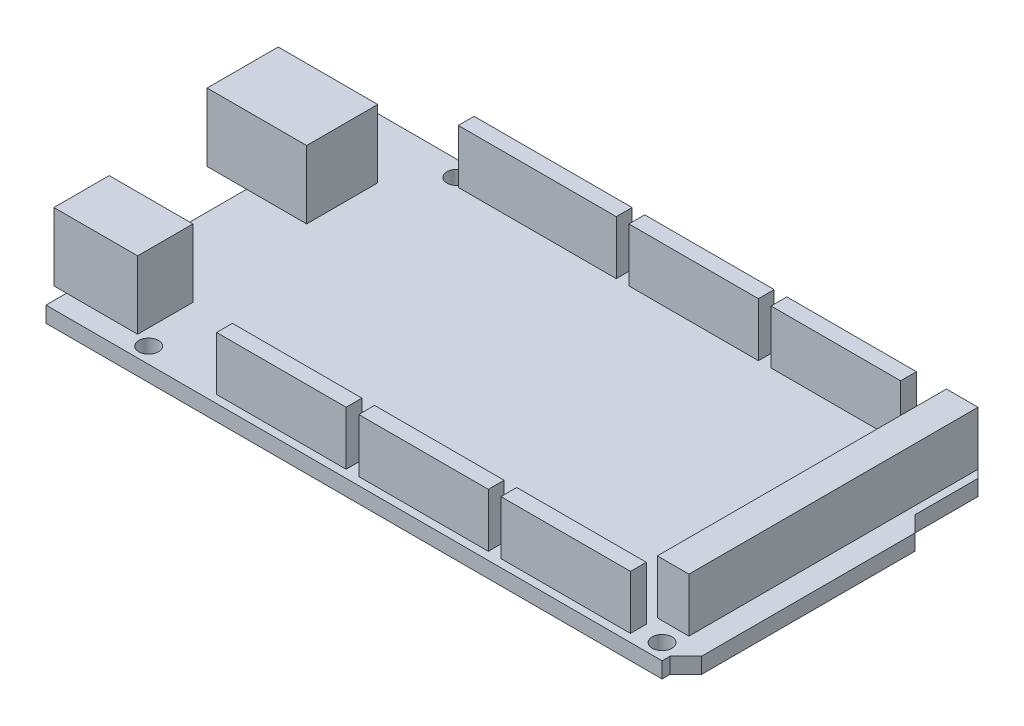
from build123d import *

# Parameters (mm, degrees)
BOSS_EXTRUDE1_DEPTH   = 2.54
SKETCH3_R             = 1.5875
CUT_EXTRUDE1_DEPTH    = 59.557880768
CHAMFER1_SIZE         = 2.54
SKETCH4_W             = 25.4
SKETCH4_H             = 2.54
BOSS_EXTRUDE2_DEPTH   = 8.636
SKETCH4_W_2           = 20.828
BOSS_EXTRUDE2_2_DEPTH = 8.636
BOSS_EXTRUDE2_3_DEPTH = 8.636
SKETCH4_W_3           = 5.08
SKETCH4_H_2           = 46.482
BOSS_EXTRUDE2_4_DEPTH = 8.636
BOSS_EXTRUDE2_5_DEPTH = 8.636
BOSS_EXTRUDE2_6_DEPTH = 8.636
BOSS_EXTRUDE2_7_DEPTH = 8.636
SKETCH5_W             = 16.002
SKETCH5_H             = 11.43
BOSS_EXTRUDE3_DEPTH   = 10.922
SKETCH5_W_2           = 13.462
SKETCH5_H_2           = 8.89
BOSS_EXTRUDE3_2_DEPTH = 10.922


with BuildPart() as part:
    # Sketch2 → Boss-Extrude1 (new body)
    with BuildSketch(Plane(origin=(0, 0, 0), x_dir=(1, 0, 0), z_dir=(0, 1, 0))):
        Polygon((-49.53, 26.67), (49.53, 26.67), (49.53, 13.97), (52.07, 13.97), (52.07, -25.4), (49.53, -25.4), (49.53, -26.67), (-49.53, -26.67), align=None)
    extrude(amount=BOSS_EXTRUDE1_DEPTH)

    # Sketch3 → Cut-Extrude1 (cut, through all)
    with BuildSketch(Plane(origin=(0, 2.54, 0), x_dir=(1, 0, 0), z_dir=(0, 1, 0))):
        with Locations(Location((-34.29, 24.13, 0), (0, 0, 270))):
            Circle(SKETCH3_R)
        with Locations(Location((40.64, 24.13, 0), (0, 0, 270))):
            Circle(SKETCH3_R)
        with Locations(Location((46.99, -24.13, 0), (0, 0, 270))):
            Circle(SKETCH3_R)
        with Locations(Location((-35.56, -24.13, 0), (0, 0, 270))):
            Circle(SKETCH3_R)
    extrude(amount=-CUT_EXTRUDE1_DEPTH, mode=Mode.SUBTRACT)

    # Chamfer1
    chamfer1_edges = [part.edges().sort_by_distance(p)[0] for p in [
        (52.07, 1.27, 25.4),
        (49.53, 1.27, -26.67),
        (52.07, 1.27, -13.97),
    ]]
    chamfer(chamfer1_edges, length=CHAMFER1_SIZE - 0.0001)  # a hair under: the kernel refuses the full size


with BuildPart() as body_2:
    # Sketch4 → Boss-Extrude2 (new body)
    with BuildSketch(Plane(origin=(0, 2.54, 0), x_dir=(1, 0, 0), z_dir=(0, 1, 0))):
        with Locations((-20.066, 24.13)):
            Rectangle(SKETCH4_W, SKETCH4_H)
    extrude(amount=BOSS_EXTRUDE2_DEPTH)


with BuildPart() as body_3:
    # Sketch4 → Boss-Extrude2 2 (new body)
    with BuildSketch(Plane(origin=(0, 2.54, 0), x_dir=(1, 0, 0), z_dir=(0, 1, 0))):
        with Locations((5.08, 24.13)):
            Rectangle(SKETCH4_W_2, SKETCH4_H)
    extrude(amount=BOSS_EXTRUDE2_2_DEPTH)


with BuildPart() as body_4:
    # Sketch4 → Boss-Extrude2 3 (new body)
    with BuildSketch(Plane(origin=(0, 2.54, 0), x_dir=(1, 0, 0), z_dir=(0, 1, 0))):
        with Locations((27.94, 24.13)):
            Rectangle(SKETCH4_W_2, SKETCH4_H)
    extrude(amount=BOSS_EXTRUDE2_3_DEPTH)


with BuildPart() as body_5:
    # Sketch4 → Boss-Extrude2 4 (new body)
    with BuildSketch(Plane(origin=(0, 2.54, 0), x_dir=(1, 0, 0), z_dir=(0, 1, 0))):
        with Locations((45.72, 2.159)):
            Rectangle(SKETCH4_W_3, SKETCH4_H_2)
    extrude(amount=BOSS_EXTRUDE2_4_DEPTH)


with BuildPart() as body_6:
    # Sketch4 → Boss-Extrude2 5 (new body)
    with BuildSketch(Plane(origin=(0, 2.54, 0), x_dir=(1, 0, 0), z_dir=(0, 1, 0))):
        with Locations((32.766, -24.13)):
            Rectangle(SKETCH4_W_2, SKETCH4_H)
    extrude(amount=BOSS_EXTRUDE2_5_DEPTH)


with BuildPart() as body_7:
    # Sketch4 → Boss-Extrude2 6 (new body)
    with BuildSketch(Plane(origin=(0, 2.54, 0), x_dir=(1, 0, 0), z_dir=(0, 1, 0))):
        with Locations((9.906, -24.13)):
            Rectangle(SKETCH4_W_2, SKETCH4_H)
    extrude(amount=BOSS_EXTRUDE2_6_DEPTH)


with BuildPart() as body_8:
    # Sketch4 → Boss-Extrude2 7 (new body)
    with BuildSketch(Plane(origin=(0, 2.54, 0), x_dir=(1, 0, 0), z_dir=(0, 1, 0))):
        with Locations((-12.954, -24.13)):
            Rectangle(SKETCH4_W_2, SKETCH4_H)
    extrude(amount=BOSS_EXTRUDE2_7_DEPTH)


with BuildPart() as body_9:
    # Sketch5 → Boss-Extrude3 (new body)
    with BuildSketch(Plane(origin=(0, 2.54, 0), x_dir=(1, 0, 0), z_dir=(0, 1, 0))):
        with Locations((-47.879, 11.303)):
            Rectangle(SKETCH5_W, SKETCH5_H)
    extrude(amount=BOSS_EXTRUDE3_DEPTH)


with BuildPart() as body_10:
    # Sketch5 → Boss-Extrude3 2 (new body)
    with BuildSketch(Plane(origin=(0, 2.54, 0), x_dir=(1, 0, 0), z_dir=(0, 1, 0))):
        with Locations((-44.831, -18.923)):
            Rectangle(SKETCH5_W_2, SKETCH5_H_2)
    extrude(amount=BOSS_EXTRUDE3_2_DEPTH)


solid = Compound([part.part, body_2.part, body_3.part, body_4.part, body_5.part, body_6.part, body_7.part, body_8.part, body_9.part, body_10.part])
